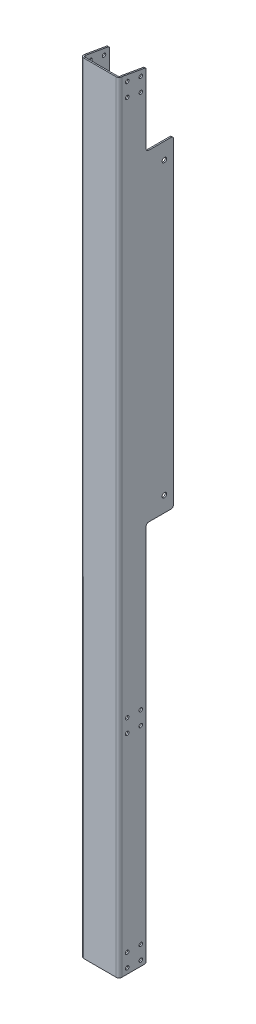
from build123d import *

# Parameters (mm, degrees)
SKETCH1_W                    = 53.35524
SKETCH1_H                    = 1092.2
BASE_FLANGE1_DEPTH           = 1.89738
EDGE_FLANGE1_STRIP_W         = 11.65352
EDGE_FLANGE1_STRIP_H         = 1.89738
EDGE_FLANGE1_STRIP_CUT_DEPTH = 1092.2
EDGE_FLANGE1_DEPTH           = 1092.2
EDGE_FLANGE1_FLAT_DEPTH      = 1.89738
EDGE_FLANGE2_STRIP_W         = 11.65352
EDGE_FLANGE2_STRIP_H         = 1.89738
EDGE_FLANGE2_STRIP_CUT_DEPTH = 1092.2
EDGE_FLANGE2_DEPTH           = 1092.2
EDGE_FLANGE2_FLAT_DEPTH      = 1.89738
FILLET1_R                    = 2.54
SKETCH12_R                   = 2.4638
CUT_EXTRUDE1_DEPTH           = 554.966092496
SKETCH13_R                   = 2.4638
CUT_EXTRUDE2_DEPTH           = 554.966092496
SKETCH14_R                   = 2.4638
CUT_EXTRUDE3_DEPTH           = 554.966092496
E_0_25_DIAMETER_HOLE1_D      = 6.35


# Sheet-metal steps are written as plain solids
with BuildPart() as part:
    # Sketch1 → Base-Flange1 (new body)
    with BuildSketch(Plane.XY):
        Rectangle(SKETCH1_W, SKETCH1_H)
    extrude(amount=-BASE_FLANGE1_DEPTH)

    # Edge-Flange1 strip (across the edge) → Edge-Flange1 strip cut (cut)
    with BuildSketch(Plane(origin=(26.67762, 546.1, -1.89738), x_dir=(-1, 0, 0), z_dir=(0, -1, 0))):
        with Locations((-1.89738, -0.94869)):
            Rectangle(EDGE_FLANGE1_STRIP_W, EDGE_FLANGE1_STRIP_H)
    extrude(amount=EDGE_FLANGE1_STRIP_CUT_DEPTH, mode=Mode.SUBTRACT)

    # Edge-Flange1 bend section (across the edge) → Edge-Flange1 (add)
    with BuildSketch(Plane(origin=(26.67762, 546.1, -1.89738), x_dir=(-1, 0, 0), z_dir=(0, -1, 0))):
        with BuildLine():
            Line((0, 2.032), (1.89738, 2.032))
            ThreePointArc((1.89738, 2.032), (2.492539021, 0.595159021), (3.92938, 0))
            Line((3.92938, 0), (3.92938, -1.89738))
            ThreePointArc((3.92938, -1.89738), (1.150888756, -0.746491244), (0, 2.032))
        make_face()
    extrude(amount=EDGE_FLANGE1_DEPTH)

    # Edge-Flange1 profile (on flange) → Edge-Flange1 flat (add)
    with BuildSketch(Plane(origin=(26.67762, 0, -1.89738), x_dir=(0, 1, 0), z_dir=(-1, 0, 0))):
        with BuildLine():
            Line((540.223938633, 36.20262), (441.325, 36.20262))
            ThreePointArc((441.325, 36.20262), (439.07993597, 37.13255597), (438.15, 39.37762))
            Line((438.15, 39.37762), (438.15, 71.12762))
            ThreePointArc((438.15, 71.12762), (437.22006403, 73.37268403), (434.975, 74.30262))
            Line((434.975, 74.30262), (-9.525, 74.30262))
            ThreePointArc((-9.525, 74.30262), (-11.77006403, 73.37268403), (-12.7, 71.12762))
            Line((-12.7, 71.12762), (-12.7, 39.37762))
            ThreePointArc((-12.7, 39.37762), (-13.62993597, 37.13255597), (-15.875, 36.20262))
            Line((-15.875, 36.20262), (-546.1, 36.20262))
            Line((-546.1, 36.20262), (-546.1, 2.032))
            Line((-546.1, 2.032), (546.1, 2.032))
            Line((546.1, 2.032), (546.1, 2.87782))
            Line((546.1, 2.87782), (540.223938633, 36.20262))
        make_face()
    extrude(amount=EDGE_FLANGE1_FLAT_DEPTH)

    # Edge-Flange2 strip (across the edge) → Edge-Flange2 strip cut (cut)
    with BuildSketch(Plane(origin=(-26.67762, -546.1, -1.89738), x_dir=(1, 0, 0), z_dir=(0, 1, 0))):
        with Locations((-1.89738, -0.94869)):
            Rectangle(EDGE_FLANGE2_STRIP_W, EDGE_FLANGE2_STRIP_H)
    extrude(amount=EDGE_FLANGE2_STRIP_CUT_DEPTH, mode=Mode.SUBTRACT)

    # Edge-Flange2 bend section (across the edge) → Edge-Flange2 (add)
    with BuildSketch(Plane(origin=(-26.67762, -546.1, -1.89738), x_dir=(1, 0, 0), z_dir=(0, 1, 0))):
        with BuildLine():
            Line((0, 2.032), (1.89738, 2.032))
            ThreePointArc((1.89738, 2.032), (2.492539021, 0.595159021), (3.92938, 0))
            Line((3.92938, 0), (3.92938, -1.89738))
            ThreePointArc((3.92938, -1.89738), (1.150888756, -0.746491244), (0, 2.032))
        make_face()
    extrude(amount=EDGE_FLANGE2_DEPTH)

    # Edge-Flange2 profile (on flange) → Edge-Flange2 flat (add)
    with BuildSketch(Plane(origin=(-26.67762, 0, -1.89738), x_dir=(0, -1, 0), z_dir=(1, 0, 0))):
        with BuildLine():
            Line((-441.325, 36.20262), (-540.223938633, 36.20262))
            Line((-540.223938633, 36.20262), (-546.1, 2.87782))
            Line((-546.1, 2.87782), (-546.1, 2.032))
            Line((-546.1, 2.032), (546.1, 2.032))
            Line((546.1, 2.032), (546.1, 36.20262))
            Line((546.1, 36.20262), (15.875, 36.20262))
            ThreePointArc((15.875, 36.20262), (13.62993597, 37.13255597), (12.7, 39.37762))
            Line((12.7, 39.37762), (12.7, 71.12762))
            ThreePointArc((12.7, 71.12762), (11.77006403, 73.37268403), (9.525, 74.30262))
            Line((9.525, 74.30262), (-434.975, 74.30262))
            ThreePointArc((-434.975, 74.30262), (-437.22006403, 73.37268403), (-438.15, 71.12762))
            Line((-438.15, 71.12762), (-438.15, 39.37762))
            ThreePointArc((-438.15, 39.37762), (-439.07993597, 37.13255597), (-441.325, 36.20262))
        make_face()
    extrude(amount=EDGE_FLANGE2_FLAT_DEPTH)

    # Fillet1
    fillet1_edges = [part.edges().sort_by_distance(p)[0] for p in [
        (25.72893, -546.1, -38.1),
        (25.72893, 540.223938633, -38.1),
        (-25.72893, -546.1, -38.1),
        (-25.72893, 540.223938633, -38.1),
    ]]
    fillet(fillet1_edges, radius=FILLET1_R)

    # Sketch12 → Cut-Extrude1 (cut, through all)
    with BuildSketch(Plane.ZY.offset(26.67762)):
        with Locations((-30.48, -538.48)):
            Circle(SKETCH12_R)
        with Locations((-30.48, -519.43)):
            Circle(SKETCH12_R)
        with Locations((-11.43, -519.43)):
            Circle(SKETCH12_R)
        with Locations((-11.43, -538.48)):
            Circle(SKETCH12_R)
    extrude(amount=-CUT_EXTRUDE1_DEPTH, mode=Mode.SUBTRACT)

    # Sketch13 → Cut-Extrude2 (cut, through all)
    with BuildSketch(Plane.ZY.offset(26.67762)):
        with Locations((-30.48, 533.262579053)):
            Circle(SKETCH13_R)
        with Locations((-11.43, 536.621608035)):
            Circle(SKETCH13_R)
        with Locations((-11.43, 517.277731079)):
            Circle(SKETCH13_R)
        with Locations((-30.48, 513.918702097)):
            Circle(SKETCH13_R)
    extrude(amount=-CUT_EXTRUDE2_DEPTH, mode=Mode.SUBTRACT)

    # Sketch14 → Cut-Extrude3 (cut, through all)
    with BuildSketch(Plane(origin=(26.67762, 0, 0), x_dir=(0, 0, -1), z_dir=(1, 0, 0))):
        with Locations((11.43, -234.95)):
            Circle(SKETCH14_R)
        with Locations((11.43, -254)):
            Circle(SKETCH14_R)
        with Locations((30.48, -254)):
            Circle(SKETCH14_R)
        with Locations((30.48, -234.95)):
            Circle(SKETCH14_R)
    extrude(amount=-CUT_EXTRUDE3_DEPTH, mode=Mode.SUBTRACT)

    # E (0.25) Diameter Hole1 (through all)
    with Locations(Plane(origin=(26.67762, 0, 0), x_dir=(0, 0, -1), z_dir=(1, 0, 0))):
        with Locations((63.5, 415.29), (63.5, 8.89)):
            Hole(E_0_25_DIAMETER_HOLE1_D / 2)


solid = part.part
